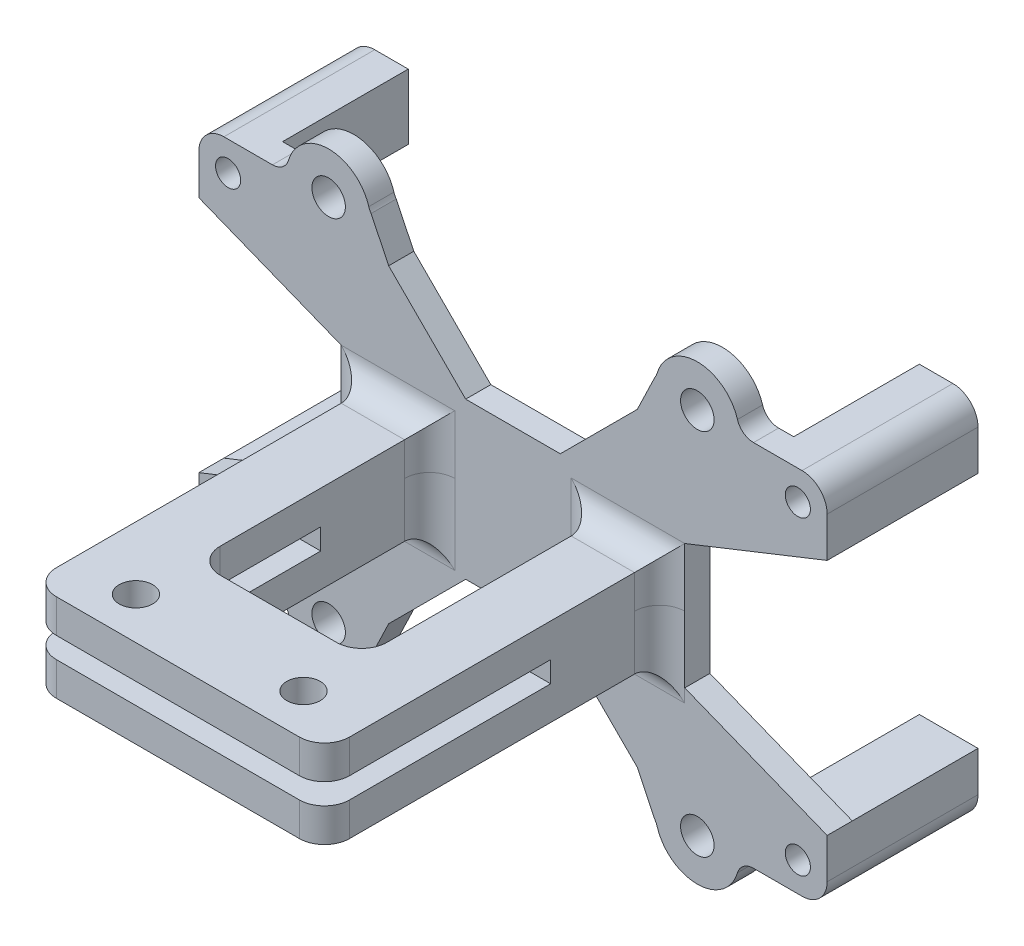
from build123d import *
from build123d.topology import SkipClean

# Parameters (mm, degrees)
SKETCH_1_R           = 1.5
EXTRUDE_1_DEPTH      = 3
SKETCH_3_W           = 35
SKETCH_3_H           = 4
EXTRUDE_2_DEPTH      = 40
CUT_EXTRUDE_3_DEPTH  = 40
SKETCH_5_R           = 2
EXTRUDE_3_DEPTH      = 4
SKETCH_4_R           = 2
CUT_EXTRUDE_4_DEPTH  = 74.181343691
EXTRUDE_START        = 4
SKETCH_6_R           = 2
SKETCH_6_W           = 11.5
SKETCH_6_H           = 11
EXTRUDE_4_DEPTH      = 4
SKETCH_7_R           = 2
SKETCH_7_W           = 19.896481546
SKETCH_7_H           = 28
CUT_EXTRUDE_5_DEPTH  = 74.181343691
CUT_EXTRUDE_6_DEPTH  = 73.339863176
FILLET_2_R           = 3
FILLET_3_R           = 3
EXTRUDE_START_2      = -18
SKETCH_10_R          = 1.5
EXTRUDE_5_DEPTH      = 18
FILLET_4_R           = 3
FILLET_5_R           = 3
FILLET_6_R           = 3
FILLET_7_R           = 3
SKETCH_12_R          = 5
SKETCH_12_R_2        = 2
EXTRUDE_6_DEPTH      = 3
SKETCH_13_R          = 2
CUT_EXTRUDE_7_DEPTH  = 3
SKETCH_14_W          = 30
SKETCH_14_H          = 40
SKETCH_14_W_2        = 75.097471979
SKETCH_14_H_2        = 56.842097172
CUT_EXTRUDE_8_DEPTH  = 75.15141077
FILLET_11_R          = 2
FILLET_12_R          = 2
CUT_EXTRUDE_9_DEPTH  = 3
CUT_EXTRUDE_10_DEPTH = 3
SKETCH_19_W          = 7.551759227
SKETCH_19_H          = 6.5
EXTRUDE_8_DEPTH      = 13
FILLET_14_R          = 3
EXTRUDE_START_3      = 2.5
SKETCH_20_R          = 2
EXTRUDE_9_DEPTH      = 4
FILLET_15_R          = 3


with BuildPart() as part:
    # 草图1 → 凸台-拉伸1 (new body)
    with BuildSketch(Plane.XY):
        with BuildLine():
            Line((-34.5, 22), (34.5, 22))
            ThreePointArc((34.5, 22), (36.621320344, 21.121320344), (37.5, 19))
            Line((37.5, 19), (37.5, -19))
            ThreePointArc((37.5, -19), (36.621320344, -21.121320344), (34.5, -22))
            Line((34.5, -22), (-34.5, -22))
            ThreePointArc((-34.5, -22), (-36.621320344, -21.121320344), (-37.5, -19))
            Line((-37.5, -19), (-37.5, 19))
            ThreePointArc((-37.5, 19), (-36.621320344, 21.121320344), (-34.5, 22))
        make_face()
        with Locations((-34, 18.5)):
            Circle(SKETCH_1_R, mode=Mode.SUBTRACT)
        with Locations((-34, -18.5)):
            Circle(SKETCH_1_R, mode=Mode.SUBTRACT)
        with Locations((34, -18.5)):
            Circle(SKETCH_1_R, mode=Mode.SUBTRACT)
        with Locations((34, 18.5)):
            Circle(SKETCH_1_R, mode=Mode.SUBTRACT)
    extrude(amount=EXTRUDE_1_DEPTH)

    # 草图3 → 凸台-拉伸2 (add)
    with BuildSketch(Plane.XY.offset(3)):
        with Locations((0, 2.462408516)):
            Rectangle(SKETCH_3_W, SKETCH_3_H)
        with Locations((0, -4.037591484)):
            Rectangle(SKETCH_3_W, SKETCH_3_H)
    extrude(amount=EXTRUDE_2_DEPTH)

    # 草图2 → 切除-拉伸3 (cut)
    with BuildSketch(Plane.XY.offset(3)):
        Polygon((14.838323353, 18.5), (-14.838323353, 18.5), (-5.64731974, 9.308996386), (5.64731974, 9.308996386), align=None)
        Polygon((-28, 4.711070882), (-37.5, 14.211070882), (-37.5, -14.211070882), (-28, -4.711070882), align=None)
        Polygon((37.5, -14.211070882), (37.5, 14.211070882), (28, 4.711070882), (28, -4.711070882), align=None)
        Polygon((-5.64731974, -9.308996386), (-14.838323353, -18.5), (14.838323353, -18.5), (5.64731974, -9.308996386), align=None)
    extrude(amount=-CUT_EXTRUDE_3_DEPTH, mode=Mode.SUBTRACT)

    # 草图5 → 凸台-拉伸3 (add)
    with BuildSketch(Plane.XZ.offset(6.037591484)):
        with BuildLine():
            Line((-24.5, 57), (24.5, 57))
            ThreePointArc((24.5, 57), (26.621320344, 56.121320344), (27.5, 54))
            Line((27.5, 54), (27.5, 3))
            Line((27.5, 3), (-27.5, 3))
            Line((-27.5, 3), (-27.5, 54))
            ThreePointArc((-27.5, 54), (-26.621320344, 56.121320344), (-24.5, 57))
        make_face()
        with Locations(Location((-22, 52, 0), (0, 0, 270))):
            Circle(SKETCH_5_R, mode=Mode.SUBTRACT)
        with Locations(Location((-22, 8, 0), (0, 0, 270))):
            Circle(SKETCH_5_R, mode=Mode.SUBTRACT)
        with Locations(Location((22, 8, 0), (0, 0, 270))):
            Circle(SKETCH_5_R, mode=Mode.SUBTRACT)
        with Locations(Location((22, 52, 0), (0, 0, 270))):
            Circle(SKETCH_5_R, mode=Mode.SUBTRACT)
    extrude(amount=-EXTRUDE_3_DEPTH)

    # 草图4 → 切除-拉伸4 (cut, through all)
    with BuildSketch(Plane(origin=(0, 4.462408516, 0), x_dir=(1, 0, 0), z_dir=(0, 1, 0))):
        with Locations(Location((-10, -38, 0), (0, 0, 180))):
            Circle(SKETCH_4_R)
        with Locations(Location((10, -38, 0), (0, 0, 180))):
            Circle(SKETCH_4_R)
    extrude(amount=-CUT_EXTRUDE_4_DEPTH, mode=Mode.SUBTRACT)

    # 草图6 → 凸台-拉伸4 (add)
    # profile 1 of 4: a face of its own
    with BuildSketch(Plane.XZ.offset(6.037591484).offset(EXTRUDE_START)):
        with BuildLine():
            Line((-27.5, 46), (-16, 46))
            Line((-16, 46), (-16, 57))
            Line((-16, 57), (-24.5, 57))
            ThreePointArc((-24.5, 57), (-26.621320344, 56.121320344), (-27.5, 54))
            Line((-27.5, 54), (-27.5, 46))
        make_face()
        with Locations((-22, 52)):
            Circle(SKETCH_6_R, mode=Mode.SUBTRACT)
    # profile 2 of 4: a face of its own
    with BuildSketch(Plane.XZ.offset(6.037591484).offset(EXTRUDE_START)):
        with Locations((-21.75, 8.5)):
            Rectangle(SKETCH_6_W, SKETCH_6_H)
        with Locations((-22, 8)):
            Circle(SKETCH_6_R, mode=Mode.SUBTRACT)
    # profile 3 of 4: a face of its own
    with BuildSketch(Plane.XZ.offset(6.037591484).offset(EXTRUDE_START)):
        with BuildLine():
            Line((24.5, 57), (16, 57))
            Line((16, 57), (16, 46))
            Line((16, 46), (27.5, 46))
            Line((27.5, 46), (27.5, 54))
            ThreePointArc((27.5, 54), (26.621320344, 56.121320344), (24.5, 57))
        make_face()
        with Locations((22, 52)):
            Circle(SKETCH_6_R, mode=Mode.SUBTRACT)
    # profile 4 of 4: a face of its own
    with BuildSketch(Plane.XZ.offset(6.037591484).offset(EXTRUDE_START)):
        with Locations((21.75, 8.5)):
            Rectangle(SKETCH_6_W, SKETCH_6_H)
        with Locations((22, 8)):
            Circle(SKETCH_6_R, mode=Mode.SUBTRACT)
    extrude(amount=-EXTRUDE_4_DEPTH)

    # 草图7 → 切除-拉伸5 (cut, through all)
    with BuildSketch(Plane(origin=(0, 4.462408516, 0), x_dir=(1, 0, 0), z_dir=(0, 1, 0))):
        with Locations(Location((-10, -38, 0), (0, 0, 180))):
            Circle(SKETCH_7_R)
        with Locations((0, -17)):
            Rectangle(SKETCH_7_W, SKETCH_7_H)
    extrude(amount=-CUT_EXTRUDE_5_DEPTH, mode=Mode.SUBTRACT)

    # 草图8 → 切除-拉伸6 (cut, through all)
    with BuildSketch(Plane(origin=(0, -2.037591484, 0), x_dir=(1, 0, 0), z_dir=(0, 1, 0))):
        Polygon((-27.5, -10.721015485), (-17.5, -18.39194813), (-17.5, -40.845407225), (-27.5, -48.99577316), align=None)
        Polygon((27.5, -10.721015485), (17.5, -18.39194813), (17.5, -40.845407225), (27.5, -48.99577316), align=None)
    extrude(amount=-CUT_EXTRUDE_6_DEPTH, mode=Mode.SUBTRACT)

    # 圆角2
    fillet_2_edges = [part.edges().sort_by_distance(p)[0] for p in [
        (-12.974120387, -6.037591484, 3),
        (12.974120387, -6.037591484, 3),
        (-13.724120387, 4.462408516, 3),
        (13.724120387, 4.462408516, 3),
    ]]
    fillet(fillet_2_edges, radius=FILLET_2_R)

    # 圆角3
    fillet_3_edges = [part.edges().sort_by_distance(p)[0] for p in [
        (-17.5, 3.962408516, 3),
        (17.5, 3.962408516, 3),
        (9.948240773, -5.537591484, 3),
        (9.948240773, 3.962408516, 3),
        (-9.948240773, -5.537591484, 3),
        (-9.948240773, 3.962408516, 3),
    ]]
    fillet(fillet_3_edges, radius=FILLET_3_R)

    # 草图10 → 凸台-拉伸5 (add)
    # profile 1 of 4: a face of its own
    with SkipClean():  # the faces are left unmerged after this step: merging them gives an invalid solid
        with BuildSketch(Plane.XY.offset(3).offset(EXTRUDE_START_2)):
            with BuildLine():
                Line((-30.5, 14.211070882), (-30.5, 22))
                Line((-30.5, 22), (-34.5, 22))
                ThreePointArc((-34.5, 22), (-36.621320344, 21.121320344), (-37.5, 19))
                Line((-37.5, 19), (-37.5, 14.211070882))
                Line((-37.5, 14.211070882), (-30.5, 14.211070882))
            make_face()
            with Locations((-34, 18.5)):
                Circle(SKETCH_10_R, mode=Mode.SUBTRACT)
        # profile 2 of 4: a face of its own
        with BuildSketch(Plane.XY.offset(3).offset(EXTRUDE_START_2)):
            with BuildLine():
                Line((-30.5, -14.211070882), (-37.5, -14.211070882))
                Line((-37.5, -14.211070882), (-37.5, -19))
                ThreePointArc((-37.5, -19), (-36.621320344, -21.121320344), (-34.5, -22))
                Line((-34.5, -22), (-30.5, -22))
                Line((-30.5, -22), (-30.5, -14.211070882))
            make_face()
            with Locations((-34, -18.5)):
                Circle(SKETCH_10_R, mode=Mode.SUBTRACT)
        # profile 3 of 4: a face of its own
        with BuildSketch(Plane.XY.offset(3).offset(EXTRUDE_START_2)):
            with BuildLine():
                Line((37.5, -19), (37.5, -14.211070882))
                Line((37.5, -14.211070882), (30.5, -14.211070882))
                Line((30.5, -14.211070882), (30.5, -22))
                Line((30.5, -22), (34.5, -22))
                ThreePointArc((34.5, -22), (36.621320344, -21.121320344), (37.5, -19))
            make_face()
            with Locations((34, -18.5)):
                Circle(SKETCH_10_R, mode=Mode.SUBTRACT)
        # profile 4 of 4: a face of its own
        with BuildSketch(Plane.XY.offset(3).offset(EXTRUDE_START_2)):
            with BuildLine():
                Line((34.5, 22), (30.5, 22))
                Line((30.5, 22), (30.5, 14.211070882))
                Line((30.5, 14.211070882), (37.5, 14.211070882))
                Line((37.5, 14.211070882), (37.5, 19))
                ThreePointArc((37.5, 19), (36.621320344, 21.121320344), (34.5, 22))
            make_face()
            with Locations((34, 18.5)):
                Circle(SKETCH_10_R, mode=Mode.SUBTRACT)
        extrude(amount=EXTRUDE_5_DEPTH)
    add(part.part.scale(1), mode=Mode.REPLACE)  # the faces are merged on a copy

    # 圆角4
    fillet_4_edges = [part.edges().sort_by_distance(p)[0] for p in [
        (-17.5, -4.037591484, 18.39194813),
        (-17.5, -4.037591484, 40.845407225),
        (17.5, -4.037591484, 40.845407225),
        (17.5, -4.037591484, 18.39194813),
    ]]
    fillet(fillet_4_edges, radius=FILLET_4_R)

    # 圆角5
    fillet_5_edges = [part.edges().sort_by_distance(p)[0] for p in [
        (-27.5, -6.037591484, 10.721015485),
        (-27.5, -6.037591484, 48.99577316),
        (27.5, -6.037591484, 48.99577316),
        (27.5, -6.037591484, 10.721015485),
    ]]
    fillet(fillet_5_edges, radius=FILLET_5_R)

    # 圆角6
    fillet_6_edges = [part.edges().sort_by_distance(p)[0] for p in [
        (9.948240773, 2.462408516, 31),
        (-9.948240773, 2.462408516, 31),
    ]]
    fillet(fillet_6_edges, radius=FILLET_6_R)

    # 圆角7
    fillet_7_edges = [part.edges().sort_by_distance(p)[0] for p in [
        (17.5, 2.462408516, 43),
        (-17.5, 2.462408516, 43),
    ]]
    fillet(fillet_7_edges, radius=FILLET_7_R)

    # 草图12 → 凸台-拉伸6 (add)
    # profile 1 of 4: a face of its own
    with BuildSketch(Plane(origin=(0, 0, 0), x_dir=(-1, 0, 0), z_dir=(0, 0, -1))):
        with Locations((-22, 22)):
            Circle(SKETCH_12_R)
        with Locations((-22, 22)):
            Circle(SKETCH_12_R_2, mode=Mode.SUBTRACT)
    # profile 2 of 4: a face of its own
    with BuildSketch(Plane(origin=(0, 0, 0), x_dir=(-1, 0, 0), z_dir=(0, 0, -1))):
        with Locations((22, 22)):
            Circle(SKETCH_12_R)
        with Locations((22, 22)):
            Circle(SKETCH_12_R_2, mode=Mode.SUBTRACT)
    # profile 3 of 4: a face of its own
    with BuildSketch(Plane(origin=(0, 0, 0), x_dir=(-1, 0, 0), z_dir=(0, 0, -1))):
        with Locations((22, -22)):
            Circle(SKETCH_12_R)
        with Locations((22, -22)):
            Circle(SKETCH_12_R_2, mode=Mode.SUBTRACT)
    # profile 4 of 4: a face of its own
    with BuildSketch(Plane(origin=(0, 0, 0), x_dir=(-1, 0, 0), z_dir=(0, 0, -1))):
        with Locations((-22, -22)):
            Circle(SKETCH_12_R)
        with Locations((-22, -22)):
            Circle(SKETCH_12_R_2, mode=Mode.SUBTRACT)
    extrude(amount=-EXTRUDE_6_DEPTH)

    # 草图13 → 切除-拉伸7 (cut)
    with BuildSketch(Plane(origin=(0, 0, 0), x_dir=(-1, 0, 0), z_dir=(0, 0, -1))):
        with Locations((-22, 22)):
            Circle(SKETCH_13_R)
        with Locations((22, 22)):
            Circle(SKETCH_13_R)
        with Locations((22, -22)):
            Circle(SKETCH_13_R)
        with Locations((-22, -22)):
            Circle(SKETCH_13_R)
    extrude(amount=-CUT_EXTRUDE_7_DEPTH, mode=Mode.SUBTRACT)

    # 草图14 → 切除-拉伸8 (cut, through all)
    with BuildSketch(Plane(origin=(0, -2.037591484, 0), x_dir=(1, 0, 0), z_dir=(0, 1, 0))):
        with Locations((-2.5, -23)):
            Rectangle(SKETCH_14_W, SKETCH_14_H)
        with Locations((0.04873599, -31.421048586)):
            Rectangle(SKETCH_14_W_2, SKETCH_14_H_2)
    extrude(amount=-CUT_EXTRUDE_8_DEPTH, mode=Mode.SUBTRACT)

    # 圆角11
    fillet_11_edges = [part.edges().sort_by_distance(p)[0] for p in [
        (27, 22, 1.5),
        (17, 22, 1.5),
        (-27, 22, 1.5),
        (-17, 22, 1.5),
    ]]
    fillet(fillet_11_edges, radius=FILLET_11_R)

    # 圆角12
    fillet_12_edges = [part.edges().sort_by_distance(p)[0] for p in [
        (-27, -22, 1.5),
        (-17, -22, 1.5),
        (27, -22, 1.5),
        (17, -22, 1.5),
    ]]
    fillet(fillet_12_edges, radius=FILLET_12_R)

    # 草图15 → 切除-拉伸9 (cut)
    with BuildSketch(Plane.XY.offset(3)):
        Polygon((-37.5, 14.211070882), (-20.5, 7.462408516), (-20.5, -7.462408516), (-37.5, -14.211070882), align=None)
        Polygon((37.5, 14.211070882), (20.5, 7.462408516), (20.5, -7.462408516), (37.5, -14.211070882), align=None)
    extrude(amount=-CUT_EXTRUDE_9_DEPTH, mode=Mode.SUBTRACT)

    # 草图17 → 切除-拉伸10 (cut)
    with BuildSketch(Plane.XY.offset(3)):
        Polygon((-17.208425762, 23.428571429), (-14.838323353, 18.5), (14.838323353, 18.5), (17.208425763, 23.428571429), align=None)
        Polygon((-14.838323353, -18.5), (-17.208425763, -23.428571429), (17.208425762, -23.428571429), (14.838323353, -18.5), align=None)
    extrude(amount=-CUT_EXTRUDE_10_DEPTH, mode=Mode.SUBTRACT)

    # 草图19 → 凸台-拉伸8 (add)
    with BuildSketch(Plane.XY.offset(3)):
        with Locations((-13.724120387, -2.787591484)):
            Rectangle(SKETCH_19_W, SKETCH_19_H)
        with Locations((13.724120387, -2.787591484)):
            Rectangle(SKETCH_19_W, SKETCH_19_H)
    extrude(amount=EXTRUDE_8_DEPTH)

    # 圆角14
    fillet_14_edges = [part.edges().sort_by_distance(p)[0] for p in [
        (-9.948240773, -2.787591484, 3),
        (9.948240773, -2.787591484, 3),
    ]]
    fillet(fillet_14_edges, radius=FILLET_14_R)

    # 草图20 → 凸台-拉伸9 (add)
    with BuildSketch(Plane.XZ.offset(-0.462408516).offset(EXTRUDE_START_3)):
        with BuildLine():
            Line((9.948240773, 16), (17.5, 16))
            Line((17.5, 16), (17.5, 40))
            ThreePointArc((17.5, 40), (16.621320344, 42.121320344), (14.5, 43))
            Line((14.5, 43), (-14.5, 43))
            ThreePointArc((-14.5, 43), (-16.621320344, 42.121320344), (-17.5, 40))
            Line((-17.5, 40), (-17.5, 16))
            Line((-17.5, 16), (-9.948240773, 16))
            Line((-9.948240773, 16), (-9.948240773, 28))
            ThreePointArc((-9.948240773, 28), (-9.069561117, 30.121320344), (-6.948240773, 31))
            Line((-6.948240773, 31), (6.948240773, 31))
            ThreePointArc((6.948240773, 31), (9.069561117, 30.121320344), (9.948240773, 28))
            Line((9.948240773, 28), (9.948240773, 16))
        make_face()
        with Locations(Location((-10, 38, 0), (0, 0, 90))):
            Circle(SKETCH_20_R, mode=Mode.SUBTRACT)
        with Locations(Location((10, 38, 0), (0, 0, 90))):
            Circle(SKETCH_20_R, mode=Mode.SUBTRACT)
    extrude(amount=EXTRUDE_9_DEPTH)

    # 圆角15
    fillet_15_edges = [part.edges().sort_by_distance(p)[0] for p in [
        (17.5, -2.787591484, 3),
        (12.224120387, -6.037591484, 3),
        (-12.224120387, -6.037591484, 3),
        (-17.5, -2.787591484, 3),
    ]]
    fillet(fillet_15_edges, radius=FILLET_15_R - 0.0001)  # a hair under: the kernel refuses the full size


solid = part.part
